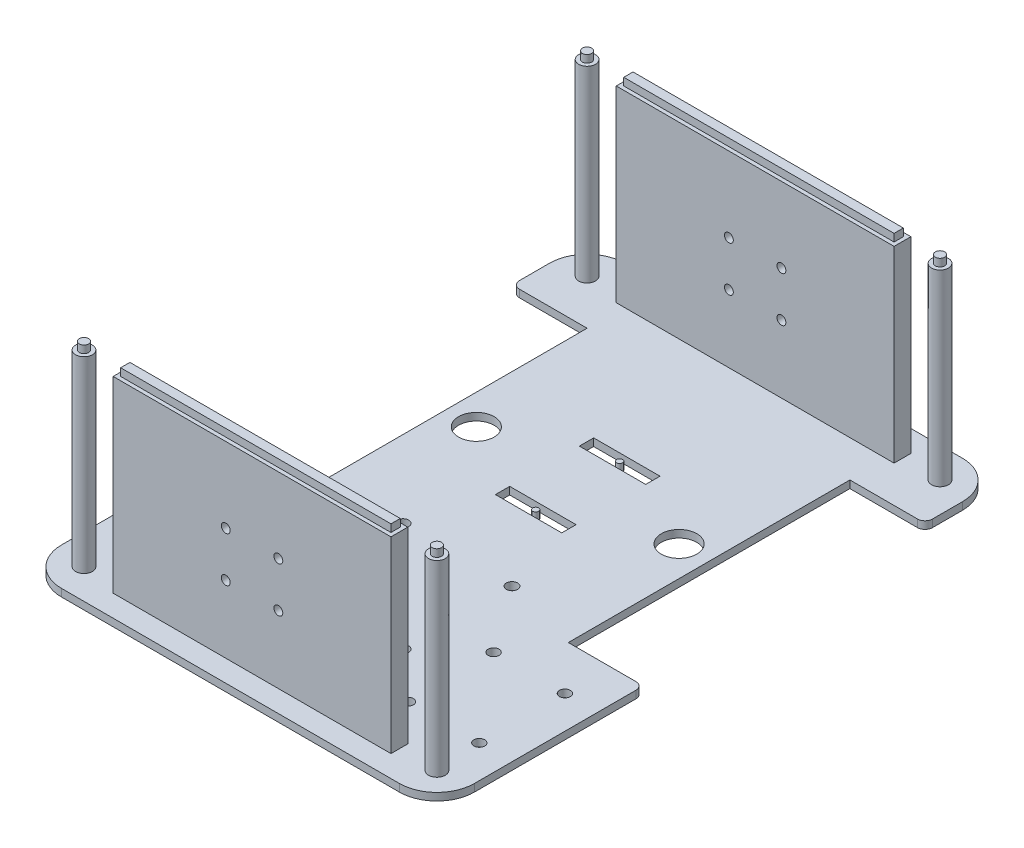
from build123d import *

# Parameters (mm, degrees)
SKETCH2_W                   = 139.7
SKETCH2_H                   = 190.5
BASE_PLATE_DEPTH            = 2.54
SKETCH4_R                   = 1.8415
L_BRACKET_HOLES_DEPTH       = 6.35
SKETCH5_W                   = 25.4
SKETCH5_H                   = 95.25
STEERING_WHEELS_HOLES_DEPTH = 6.35
FILLET1_R                   = 12.7
FILLET2_R                   = 2.54
SKETCH13_R                  = 1.905
HOLES_FOR_L298_DEPTH        = 6.35
SKETCH14_W                  = 22.44051626
SKETCH14_H                  = 4.83
SKETCH14_R                  = 0.9906
CUT_EXTRUDE4_DEPTH          = 6.35
SKETCH15_R                  = 2.84
SKETCH15_R_2                = 1.57
BOSS_EXTRUDE3_DEPTH         = 63.5
SKETCH15_2_R                = 1.57
BOSS_EXTRUDE4_DEPTH         = 66.04
SKETCH23_R                  = 2.84
SKETCH23_R_2                = 1.57
BOSS_EXTRUDE5_DEPTH         = 63.5
SKETCH23_2_R                = 1.57
BOSS_EXTRUDE6_DEPTH         = 66.04
SKETCH24_W                  = 93.98
SKETCH24_H                  = 5.68
BOSS_EXTRUDE7_DEPTH         = 63.5
SKETCH25_W                  = 91.44
SKETCH25_H                  = 3.14
BOSS_EXTRUDE8_DEPTH         = 2.54
SKETCH26_R                  = 1.5
CUT_EXTRUDE5_DEPTH          = 208.694851405
SKETCH18_R                  = 6
CUT_EXTRUDE6_DEPTH          = 136.325040551


with BuildPart() as part:
    # Sketch2 → Base Plate (new body)
    with BuildSketch(Plane(origin=(0, 0, 0), x_dir=(1, 0, 0), z_dir=(0, 1, 0))):
        Rectangle(SKETCH2_W, SKETCH2_H)
    extrude(amount=BASE_PLATE_DEPTH)

    # Sketch4 → L-Bracket holes (cut)
    with BuildSketch(Plane(origin=(0, 2.54, 0), x_dir=(1, 0, 0), z_dir=(0, 1, 0))):
        with Locations((-58.79, -69.85)):
            Circle(SKETCH4_R)
        with Locations((-34.66, -69.85)):
            Circle(SKETCH4_R)
        with Locations((-34.66, -40.894)):
            Circle(SKETCH4_R)
        with Locations((-58.79, -40.894)):
            Circle(SKETCH4_R)
        with Locations((34.66, -69.85)):
            Circle(SKETCH4_R)
        with Locations((58.79, -69.85)):
            Circle(SKETCH4_R)
        with Locations((58.79, -40.894)):
            Circle(SKETCH4_R)
        with Locations((34.66, -40.894)):
            Circle(SKETCH4_R)
    extrude(amount=-L_BRACKET_HOLES_DEPTH, mode=Mode.SUBTRACT)

    # Sketch5 → Steering Wheels Holes (cut)
    with BuildSketch(Plane(origin=(0, 2.54, 0), x_dir=(1, 0, 0), z_dir=(0, 1, 0))):
        with Locations((-57.15, 22.225)):
            Rectangle(SKETCH5_W, SKETCH5_H)
        with Locations((57.15, 22.225)):
            Rectangle(SKETCH5_W, SKETCH5_H)
    extrude(amount=-STEERING_WHEELS_HOLES_DEPTH, mode=Mode.SUBTRACT)

    # Fillet1
    fillet1_edges = [part.edges().sort_by_distance(p)[0] for p in [
        (69.85, 1.27, -95.25),
        (-69.85, 1.27, -95.25),
        (69.85, 1.27, 95.25),
        (-69.85, 1.27, 95.25),
    ]]
    fillet(fillet1_edges, radius=FILLET1_R)

    # Fillet2
    fillet2_edges = [part.edges().sort_by_distance(p)[0] for p in [
        (69.85, 1.27, -69.85),
        (69.85, 1.27, 25.4),
        (-69.85, 1.27, 25.4),
        (-69.85, 1.27, -69.85),
    ]]
    fillet(fillet2_edges, radius=FILLET2_R)

    # Sketch13 → Holes for L298 (cut)
    with BuildSketch(Plane(origin=(0, 2.54, 0), x_dir=(1, 0, 0), z_dir=(0, 1, 0))):
        with Locations((-18.415, -18.415)):
            Circle(SKETCH13_R)
        with Locations((-18.415, -55.245)):
            Circle(SKETCH13_R)
        with Locations((18.415, -55.245)):
            Circle(SKETCH13_R)
        with Locations((18.415, -18.415)):
            Circle(SKETCH13_R)
    extrude(amount=-HOLES_FOR_L298_DEPTH, mode=Mode.SUBTRACT)

    # Sketch14 → Cut-Extrude4 (cut)
    # profile 1 of 2: a face of its own
    with BuildSketch(Plane(origin=(0, 2.54, 0), x_dir=(1, 0, 0), z_dir=(0, 1, 0))):
        with Locations((0, 36.425)):
            Rectangle(SKETCH14_W, SKETCH14_H)
        with Locations((0, 36.425)):
            Circle(SKETCH14_R, mode=Mode.SUBTRACT)
    # profile 2 of 2: a face of its own
    with BuildSketch(Plane(origin=(0, 2.54, 0), x_dir=(1, 0, 0), z_dir=(0, 1, 0))):
        with Locations((0, 8.025)):
            Rectangle(SKETCH14_W, SKETCH14_H)
        with Locations((0, 8.025)):
            Circle(SKETCH14_R, mode=Mode.SUBTRACT)
    extrude(amount=-CUT_EXTRUDE4_DEPTH, mode=Mode.SUBTRACT)


with BuildPart() as cut_extrude4_piece_1:
    # of the separate pieces the step leaves, piece 1, a body of its own (cut_extrude4_pieces)
    add(part.part.solids().sort_by_distance((-69.85, 0, 27.94))[0])

    # Sketch15 → Boss-Extrude3 (add)
    with BuildSketch(Plane(origin=(0, 2.54, 0), x_dir=(1, 0, 0), z_dir=(0, 1, 0))):
        with Locations((-59.69, 85.09)):
            Circle(SKETCH15_R)
        with Locations((-59.69, 85.09)):
            Circle(SKETCH15_R_2, mode=Mode.SUBTRACT)
    boss_extrude3 = extrude(amount=BOSS_EXTRUDE3_DEPTH)

    # Sketch15<2> → Boss-Extrude4 (add)
    with BuildSketch(Plane(origin=(0, 2.54, 0), x_dir=(1, 0, 0), z_dir=(0, 1, 0))):
        with Locations((-59.69, 85.09)):
            Circle(SKETCH15_2_R)
    boss_extrude4 = extrude(amount=BOSS_EXTRUDE4_DEPTH)

    # Mirror1: Boss-Extrude4 across plane
    add(boss_extrude4.mirror(Plane(origin=(0, 0, 0), x_dir=(0, 0, 1), z_dir=(1, 0, 0))))

    # Mirror2: Boss-Extrude3 across plane
    add(boss_extrude3.mirror(Plane(origin=(0, 0, 0), x_dir=(0, 0, 1), z_dir=(1, 0, 0))))

    # Sketch23 → Boss-Extrude5 (add)
    with BuildSketch(Plane(origin=(0, 2.54, 0), x_dir=(1, 0, 0), z_dir=(0, 1, 0))):
        with Locations((-59.69, -85.09)):
            Circle(SKETCH23_R)
        with Locations((-59.69, -85.09)):
            Circle(SKETCH23_R_2, mode=Mode.SUBTRACT)
    boss_extrude5 = extrude(amount=BOSS_EXTRUDE5_DEPTH)

    # Sketch23<2> → Boss-Extrude6 (add)
    with BuildSketch(Plane(origin=(0, 2.54, 0), x_dir=(1, 0, 0), z_dir=(0, 1, 0))):
        with Locations((-59.69, -85.09)):
            Circle(SKETCH23_2_R)
    boss_extrude6 = extrude(amount=BOSS_EXTRUDE6_DEPTH)

    # Mirror3: Boss-Extrude5, Boss-Extrude6 across plane
    add(boss_extrude5.mirror(Plane(origin=(0, 0, 0), x_dir=(0, 0, 1), z_dir=(1, 0, 0))))
    add(boss_extrude6.mirror(Plane(origin=(0, 0, 0), x_dir=(0, 0, 1), z_dir=(1, 0, 0))))

    # Sketch24 → Boss-Extrude7 (add)
    with BuildSketch(Plane(origin=(0, 2.54, 0), x_dir=(1, 0, 0), z_dir=(0, 1, 0))):
        with Locations((0, -85.09)):
            Rectangle(SKETCH24_W, SKETCH24_H)
        with Locations((0, 85.09)):
            Rectangle(SKETCH24_W, SKETCH24_H)
    extrude(amount=BOSS_EXTRUDE7_DEPTH)

    # Sketch25 → Boss-Extrude8 (add)
    with BuildSketch(Plane(origin=(0, 66.04, 0), x_dir=(1, 0, 0), z_dir=(0, 1, 0))):
        with Locations((0, -85.09)):
            Rectangle(SKETCH25_W, SKETCH25_H)
        with Locations((0, 85.09)):
            Rectangle(SKETCH25_W, SKETCH25_H)
    extrude(amount=BOSS_EXTRUDE8_DEPTH)

    # Sketch26 → Cut-Extrude5 (cut, through all)
    with BuildSketch(Plane(origin=(0, 0, -87.93), x_dir=(-1, 0, 0), z_dir=(0, 0, -1))):
        with Locations((-8.89, 40.64)):
            Circle(SKETCH26_R)
        with Locations((-8.89, 25.4)):
            Circle(SKETCH26_R)
        with Locations((8.89, 25.4)):
            Circle(SKETCH26_R)
        with Locations((8.89, 40.64)):
            Circle(SKETCH26_R)
    extrude(amount=-CUT_EXTRUDE5_DEPTH, mode=Mode.SUBTRACT)

    # Sketch18 → Cut-Extrude6 (cut, through all)
    with BuildSketch(Plane(origin=(0, 2.54, 0), x_dir=(1, 0, 0), z_dir=(0, 1, 0))):
        with Locations((34.29, 22.225)):
            Circle(SKETCH18_R)
        with Locations((-34.29, 22.225)):
            Circle(SKETCH18_R)
    extrude(amount=-CUT_EXTRUDE6_DEPTH, mode=Mode.SUBTRACT)


with BuildPart() as cut_extrude4_piece_2:
    # of the separate pieces the step leaves, piece 2, a body of its own (cut_extrude4_pieces)
    add(part.part.solids().sort_by_distance((0.9906, 0, -36.425))[0])


with BuildPart() as cut_extrude4_piece_3:
    # of the separate pieces the step leaves, piece 3, a body of its own (cut_extrude4_pieces)
    add(part.part.solids().sort_by_distance((0.9906, 0, -8.025))[0])


solid = Compound([cut_extrude4_piece_1.part, cut_extrude4_piece_2.part, cut_extrude4_piece_3.part])
